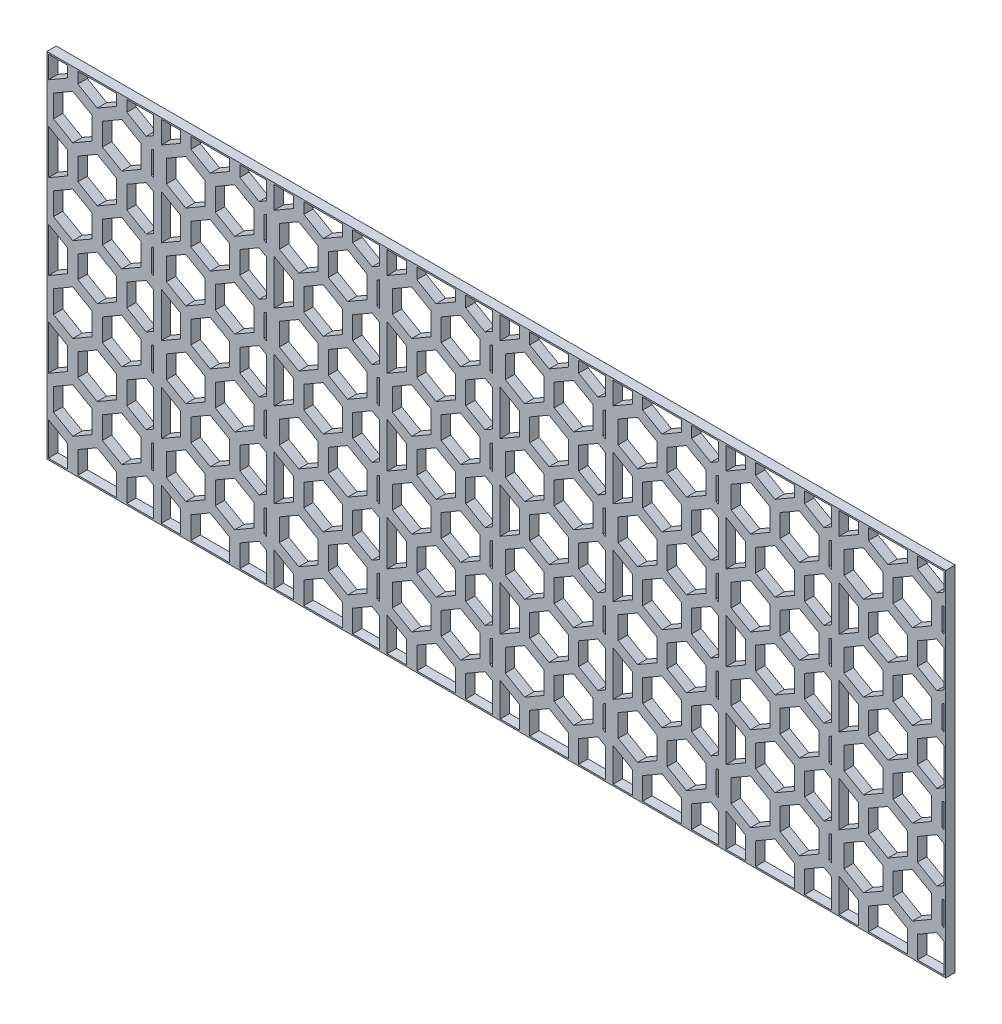
from build123d import *

# Parameters (mm, degrees)
BOSS_EXTRUDE1_DEPTH = 6.35
SKETCH2_W           = 76.2
SKETCH2_H           = 238.125
SKETCH2_W_2         = 70.993
SKETCH2_H_2         = 236.093
BOSS_EXTRUDE3_DEPTH = 6.35
LPATTERN1_COUNT     = 8
LPATTERN1_PITCH     = 76.2
SKETCH5_W           = 6.35
SKETCH5_H           = 238.125
CUT_EXTRUDE1_DEPTH  = 1.5875
SKETCH6_W           = 6.35
SKETCH6_H           = 238.125
CUT_EXTRUDE2_DEPTH  = 1.5875


# Read off the part's stored shape, not the designer's step: Boss-Extrude1
with BuildPart() as part:
    # Boss-Extrude1 outline → Boss-Extrude1 (new body)
    with BuildSketch(Plane.XY):
        Polygon((69.441981069, 215.050653537), (70.993, 215.946134734), (70.993, 223.915520587), (65.991135768, 221.027692926), (52.944197127, 228.560346463), (52.944197127, 236.093), (46.042506526, 236.093), (46.042506526, 228.560346463), (32.995567884, 221.027692926), (19.948629242, 228.560346463), (19.948629242, 236.093), (13.046938642, 236.093), (13.046938642, 228.560346463), (0, 221.027692926), (0, 194.008307074), (13.046938642, 186.475653537), (13.046938642, 171.410346463), (0, 163.877692926), (0, 136.858307074), (13.046938642, 129.325653537), (13.046938642, 114.260346463), (0, 106.727692926), (0, 79.708307074), (13.046938642, 72.175653537), (13.046938642, 57.110346463), (0, 49.577692926), (0, 22.558307074), (13.046938642, 15.025653537), (13.046938642, 0), (19.948629242, 0), (19.948629242, 15.025653537), (32.995567884, 22.558307074), (46.042506526, 15.025653537), (46.042506526, 0), (52.944197127, 0), (52.944197127, 15.025653537), (65.991135768, 22.558307074), (70.993, 19.670479413), (70.993, 27.639865266), (69.441981069, 28.535346463), (69.441981069, 43.600653537), (70.993, 44.496134734), (70.993, 52.465520587), (65.991135768, 49.577692926), (52.944197127, 57.110346463), (52.944197127, 72.175653537), (65.991135768, 79.708307074), (70.993, 76.820479413), (70.993, 84.789865266), (69.441981069, 85.685346463), (69.441981069, 100.750653537), (70.993, 101.646134734), (70.993, 109.615520587), (65.991135768, 106.727692926), (52.944197127, 114.260346463), (52.944197127, 129.325653537), (65.991135768, 136.858307074), (70.993, 133.970479413), (70.993, 141.939865266), (69.441981069, 142.835346463), (69.441981069, 157.900653537), (70.993, 158.796134734), (70.993, 166.765520587), (65.991135768, 163.877692926), (52.944197127, 171.410346463), (52.944197127, 186.475653537), (65.991135768, 194.008307074), (70.993, 191.120479413), (70.993, 199.089865266), (69.441981069, 199.985346463), align=None)
        Polygon((16.497783942, 51.133307074), (29.544722584, 43.600653537), (29.544722584, 28.535346463), (16.497783942, 21.002692926), (3.4508453, 28.535346463), (3.4508453, 43.600653537), align=None, mode=Mode.SUBTRACT)
        Polygon((16.497783942, 108.283307074), (29.544722584, 100.750653537), (29.544722584, 85.685346463), (16.497783942, 78.152692926), (3.4508453, 85.685346463), (3.4508453, 100.750653537), align=None, mode=Mode.SUBTRACT)
        Polygon((32.995567884, 79.708307074), (46.042506526, 72.175653537), (46.042506526, 57.110346463), (32.995567884, 49.577692926), (19.948629242, 57.110346463), (19.948629242, 72.175653537), align=None, mode=Mode.SUBTRACT)
        Polygon((49.493351826, 51.133307074), (62.540290468, 43.600653537), (62.540290468, 28.535346463), (49.493351826, 21.002692926), (36.446413185, 28.535346463), (36.446413185, 43.600653537), align=None, mode=Mode.SUBTRACT)
        Polygon((49.493351826, 108.283307074), (62.540290468, 100.750653537), (62.540290468, 85.685346463), (49.493351826, 78.152692926), (36.446413185, 85.685346463), (36.446413185, 100.750653537), align=None, mode=Mode.SUBTRACT)
        Polygon((16.497783942, 165.433307074), (29.544722584, 157.900653537), (29.544722584, 142.835346463), (16.497783942, 135.302692926), (3.4508453, 142.835346463), (3.4508453, 157.900653537), align=None, mode=Mode.SUBTRACT)
        Polygon((32.995567884, 136.858307074), (46.042506526, 129.325653537), (46.042506526, 114.260346463), (32.995567884, 106.727692926), (19.948629242, 114.260346463), (19.948629242, 129.325653537), align=None, mode=Mode.SUBTRACT)
        Polygon((16.497783942, 222.583307074), (29.544722584, 215.050653537), (29.544722584, 199.985346463), (16.497783942, 192.452692926), (3.4508453, 199.985346463), (3.4508453, 215.050653537), align=None, mode=Mode.SUBTRACT)
        Polygon((32.995567884, 194.008307074), (46.042506526, 186.475653537), (46.042506526, 171.410346463), (32.995567884, 163.877692926), (19.948629242, 171.410346463), (19.948629242, 186.475653537), align=None, mode=Mode.SUBTRACT)
        Polygon((49.493351826, 165.433307074), (62.540290468, 157.900653537), (62.540290468, 142.835346463), (49.493351826, 135.302692926), (36.446413185, 142.835346463), (36.446413185, 157.900653537), align=None, mode=Mode.SUBTRACT)
        Polygon((49.493351826, 222.583307074), (62.540290468, 215.050653537), (62.540290468, 199.985346463), (49.493351826, 192.452692926), (36.446413185, 199.985346463), (36.446413185, 215.050653537), align=None, mode=Mode.SUBTRACT)
    extrude(amount=BOSS_EXTRUDE1_DEPTH)

    # Sketch2 → Boss-Extrude3 (add)
    with BuildSketch(Plane.XY):
        with Locations((35.4965, 118.0465)):
            Rectangle(SKETCH2_W, SKETCH2_H)
        with Locations((35.4965, 118.0465)):
            Rectangle(SKETCH2_W_2, SKETCH2_H_2, mode=Mode.SUBTRACT)
    extrude(amount=BOSS_EXTRUDE3_DEPTH)


with BuildPart() as lpattern1_1:
    # LPattern1: pattern copy
    add(part.part.moved(Location(Vector(1, 0, 0) * (1 * LPATTERN1_PITCH))))


with BuildPart() as lpattern1_2:
    # LPattern1: pattern copy
    add(part.part.moved(Location(Vector(1, 0, 0) * (2 * LPATTERN1_PITCH))))


with BuildPart() as lpattern1_3:
    # LPattern1: pattern copy
    add(part.part.moved(Location(Vector(1, 0, 0) * (3 * LPATTERN1_PITCH))))


with BuildPart() as lpattern1_4:
    # LPattern1: pattern copy
    add(part.part.moved(Location(Vector(1, 0, 0) * (4 * LPATTERN1_PITCH))))


with BuildPart() as lpattern1_5:
    # LPattern1: pattern copy
    add(part.part.moved(Location(Vector(1, 0, 0) * (5 * LPATTERN1_PITCH))))


with BuildPart() as lpattern1_6:
    # LPattern1: pattern copy
    add(part.part.moved(Location(Vector(1, 0, 0) * (6 * LPATTERN1_PITCH))))


with BuildPart() as lpattern1_7:
    # LPattern1: pattern copy
    add(part.part.moved(Location(Vector(1, 0, 0) * (7 * LPATTERN1_PITCH))))

    # Sketch6 → Cut-Extrude2 (cut)
    with BuildSketch(Plane(origin=(606.9965, 0, 0), x_dir=(0, 0, -1), z_dir=(1, 0, 0))):
        with Locations((-3.175, 118.0465)):
            Rectangle(SKETCH6_W, SKETCH6_H)
    extrude(amount=-CUT_EXTRUDE2_DEPTH, mode=Mode.SUBTRACT)


with BuildPart() as part_1:
    add(part.part)

    # Sketch5 → Cut-Extrude1 (cut)
    with BuildSketch(Plane.ZY.offset(2.6035)):
        with Locations((3.175, 118.0465)):
            Rectangle(SKETCH5_W, SKETCH5_H)
    extrude(amount=-CUT_EXTRUDE1_DEPTH, mode=Mode.SUBTRACT)


with BuildPart() as lpattern1_5_1:
    add(lpattern1_5.part)

    # Combine1: union LPattern1_7, LPattern1_2, LPattern1_4, LPattern1_6, LPattern1_1, part, LPattern1_3
    add(lpattern1_7.part)
    add(lpattern1_2.part)
    add(lpattern1_4.part)
    add(lpattern1_6.part)
    add(lpattern1_1.part)
    add(part_1.part)
    add(lpattern1_3.part)


solid = lpattern1_5_1.part
